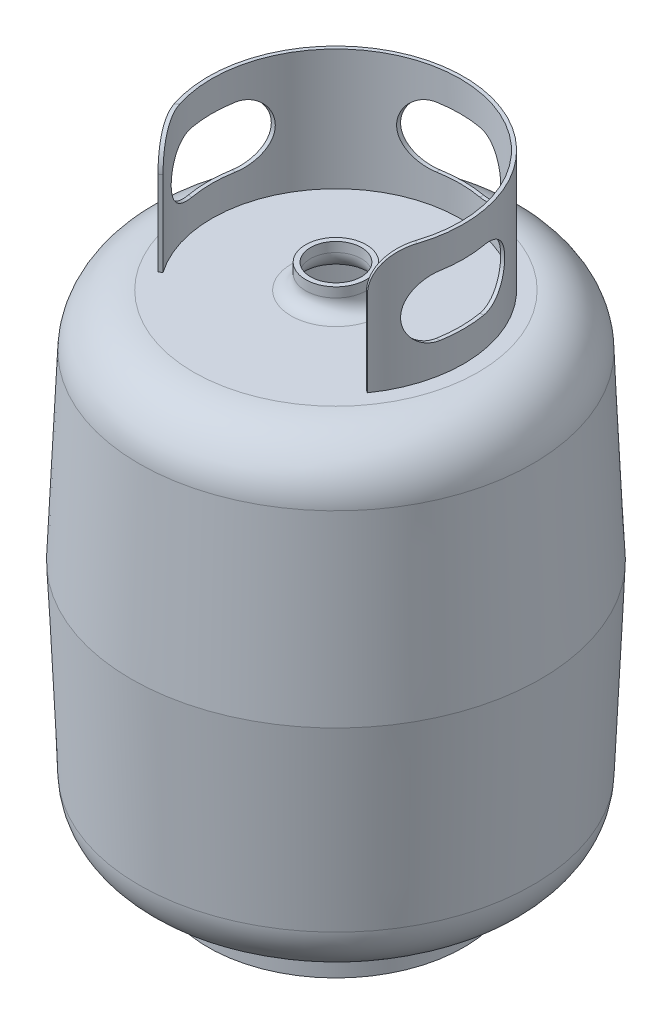
from build123d import *

# Parameters (mm, degrees)
BOSS_EXTRUDE2_DEPTH     = 100
FILLET1_START           = -107
FILLET1_DEPTH           = 162.599991324
FILLET1_START_2         = -54.236155173
FILLET1_2_DEPTH         = 161.236155173
CUT_EXTRUDE1_REACH      = 380.768
CUT_EXTRUDE1_END_RADIUS = 105.542830029
CIRPATTERN1_COUNT       = 4
BOSS_EXTRUDE4_START     = 30
SKETCH4_R               = 105.542830029
SKETCH4_R_2             = 102.542830029
BOSS_EXTRUDE4_DEPTH     = 30


with BuildPart() as part:
    # Sketch1 → Revolve1 (revolve)
    with BuildSketch(Plane(origin=(0, 0, 0), x_dir=(0, 0, -1), z_dir=(1, 0, 0))):
        with BuildLine():
            Line((-37, 193.75), (-117.542830029, 193.75))
            ThreePointArc((-117.542830029, 193.75), (-148.660917539, 181.256378293), (-162.5, 150.712872431))
            Line((-162.5, 150.712872431), (-169.080266119, 0))
            Line((-169.080266119, 0), (-162.5, -150.712872431))
            ThreePointArc((-162.5, -150.712872431), (-148.660917539, -181.256378293), (-117.542830029, -193.75))
            Line((-117.542830029, -193.75), (0, -193.75))
            Line((0, -193.75), (0, 213.75))
            Line((0, 213.75), (-25, 213.75))
            Line((-25, 213.75), (-25, 205.75))
            ThreePointArc((-25, 205.75), (-28.514718626, 197.264718626), (-37, 193.75))
        make_face()
    revolve(axis=Axis((0, 213.75, 0), (0, -1, 0)))

    # Shell1: read off the stored shape, not the designer's step
    # Shell1 outline → Shell1 (revolve, cut)
    with BuildSketch(Plane.XY):
        with BuildLine():
            ThreePointArc((117.542830029, -189.75), (145.894865316, -178.366922444), (158.503807114, -150.538394882))
            Line((158.503807114, -150.538394882), (165.076455378, 0))
            Line((165.076455378, 0), (158.503807114, 150.538394882))
            ThreePointArc((158.503807114, 150.538394882), (145.894865316, 178.366922444), (117.542830029, 189.75))
            Line((117.542830029, 189.75), (37, 189.75))
            ThreePointArc((37, 189.75), (25.686291501, 194.436291501), (21, 205.75))
            Line((21, 205.75), (21, 213.75))
            Line((21, 213.75), (0, 213.75))
            Line((0, 213.75), (0, -189.75))
            Line((0, -189.75), (117.542830029, -189.75))
        make_face()
    revolve(axis=Axis((0, 0, 0), (0, 1, 0)), mode=Mode.SUBTRACT)

    # Sketch2 → Boss-Extrude2 (add)
    with BuildSketch(Plane(origin=(0, 193.75, 0), x_dir=(1, 0, 0), z_dir=(0, 1, 0))):
        with BuildLine():
            ThreePointArc((86.455624978, -60.53688033), (0, 105.542830029), (-86.455624978, -60.53688033))
            Line((-86.455624978, -60.53688033), (-83.998168845, -58.816151021))
            ThreePointArc((-83.998168845, -58.816151021), (0, 102.542830029), (83.998168845, -58.816151021))
            Line((83.998168845, -58.816151021), (86.455624978, -60.53688033))
        make_face()
    extrude(amount=BOSS_EXTRUDE2_DEPTH)

    # Fillet1: read off the stored shape, not the designer's step
    # Fillet1 outline → Fillet1 (cut)
    with BuildSketch(Plane(origin=(0, 0, 0), x_dir=(0.5735764363510505, 0, 0.8191520442889886), z_dir=(0.8191520442889886, 0, -0.5735764363510508)).offset(FILLET1_START)):
        with BuildLine():
            Line((0, -293.75), (0, -263.75))
            ThreePointArc((0, -263.75), (-8.786796564, -284.963203436), (-30, -293.75))
            Line((-30, -293.75), (0, -293.75))
        make_face()
    extrude(amount=FILLET1_DEPTH, mode=Mode.SUBTRACT)

    # Fillet1 2 outline → Fillet1 2 (cut)
    with BuildSketch(Plane(origin=(0, 0, 0), x_dir=(0.5735764363510505, 0, -0.8191520442889886), z_dir=(0.8191520442889886, 0, 0.5735764363510508)).offset(FILLET1_START_2)):
        with BuildLine():
            Line((0, 293.75), (0, 263.75))
            ThreePointArc((0, 263.75), (8.786796564, 284.963203436), (30, 293.75))
            Line((30, 293.75), (0, 293.75))
        make_face()
    extrude(amount=FILLET1_2_DEPTH, mode=Mode.SUBTRACT)

    # Cut-Extrude1: up to this cylinder (the profile starts inside it)
    cut_extrude1_end = Plane(origin=(0, 243.75, 0), z_dir=(0, -1, 0)) * Cylinder(CUT_EXTRUDE1_END_RADIUS, 973.621660058, mode=Mode.PRIVATE)
    # Sketch3 → Cut-Extrude1 (cut, up to the surface)
    with BuildSketch(Plane(origin=(0, 0, 0), x_dir=(0, 0, -1), z_dir=(1, 0, 0)), mode=Mode.PRIVATE) as cut_extrude1_sk1:
        with BuildLine():
            Line((18, 218.75), (-18, 218.75))
            ThreePointArc((-18, 218.75), (-43, 243.75), (-18, 268.75))
            Line((-18, 268.75), (18, 268.75))
            ThreePointArc((18, 268.75), (43, 243.75), (18, 218.75))
        make_face()
    cut_extrude1_tool1 = extrude(cut_extrude1_sk1.sketch, amount=-CUT_EXTRUDE1_REACH, mode=Mode.PRIVATE) & cut_extrude1_end
    cut_extrude1 = cut_extrude1_tool1.solids().sort_by_distance((0, 243.75, 0))[0]
    add(cut_extrude1, mode=Mode.SUBTRACT)

    # CirPattern1: Cut-Extrude1 ×4 about axis
    cirpattern1_axis = Axis((0, 293.75, 0), (0, -1, 0))
    for i in range(1, CIRPATTERN1_COUNT):
        add(cut_extrude1.rotate(cirpattern1_axis, i * 360 / CIRPATTERN1_COUNT), mode=Mode.SUBTRACT)

    # Sketch4 → Boss-Extrude4 (add)
    with BuildSketch(Plane.XZ.offset(193.75).offset(BOSS_EXTRUDE4_START)):
        with Locations(Location((0, 0, 0), (0, 0, 270))):
            Circle(SKETCH4_R)
        with Locations(Location((0, 0, 0), (0, 0, 270))):
            Circle(SKETCH4_R_2, mode=Mode.SUBTRACT)
    extrude(amount=-BOSS_EXTRUDE4_DEPTH)


solid = part.part
